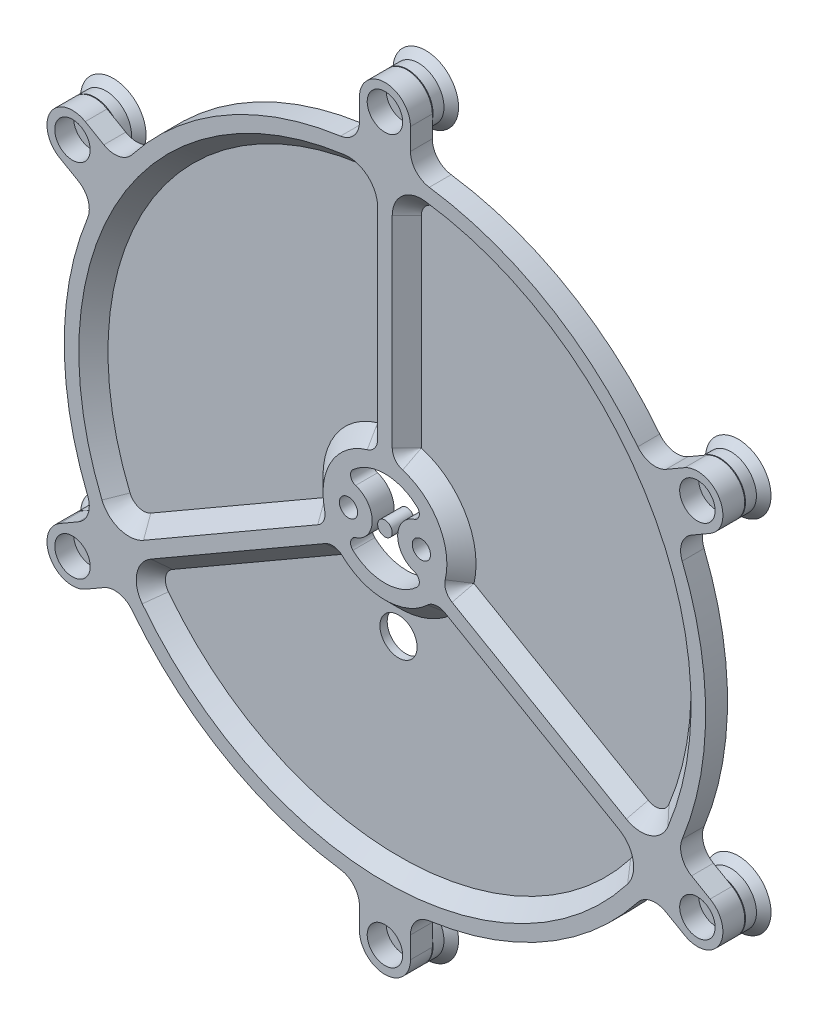
from build123d import *

# Parameters (mm, degrees)
SKETCH1_R                = 44
SKETCH1_R_2              = 42
BOSS_EXTRUDE1_DEPTH      = 1.5
SKETCH1_R_3              = 8.5
BOSS_EXTRUDE1_2_DEPTH    = 1.5
BOSS_EXTRUDE3_START      = -1.5
SKETCH1_3_R              = 42
SKETCH1_3_R_2            = 8.5
BOSS_EXTRUDE3_DEPTH      = 1
BOSS_EXTRUDE2_DEPTH      = 1.5
CIRPATTERN1_COUNT        = 3
CUT_EXTRUDE1_DEPTH       = 63.243473553
CUT_EXTRUDE1_DEPTH_BACK  = 63.243473553
SKETCH3_R                = 1.25
CUT_EXTRUDE2_DEPTH       = 63.243473553
CUT_EXTRUDE2_DEPTH_BACK  = 63.243473553
FILLET1_R                = 1
FILLET2_R                = 4
FILLET3_R                = 2
CHAMFER1_SIZE            = 2
SKETCH6_R                = 2.55
CUT_EXTRUDE3_DEPTH       = 63.297672655
BOSS_EXTRUDE4_START      = -3
BOSS_EXTRUDE4_DEPTH      = 3
FILLET4_R                = 3
CUT_EXTRUDE4_START       = -3
SKETCH9_R                = 2.43125
CUT_EXTRUDE4_DEPTH       = 2.6
CIRPATTERN2_COUNT        = 6
FILLET4_OF_CIRPATTERN2_R = 3
BOSS_EXTRUDE5_START      = 0.1
SKETCH11_R               = 2.40625
BOSS_EXTRUDE5_DEPTH      = 1.6
CIRPATTERN3_COUNT        = 6
BOSS_EXTRUDE6_START      = -1.5
SKETCH12_R               = 1
BOSS_EXTRUDE6_DEPTH      = 3


with BuildPart() as part:
    # Sketch1 → Boss-Extrude1 (new, symmetric)
    with BuildSketch(Plane.XY):
        Circle(SKETCH1_R)
        Circle(SKETCH1_R_2, mode=Mode.SUBTRACT)
    extrude(amount=BOSS_EXTRUDE1_DEPTH, both=True)



with BuildPart() as body_2:
    # Sketch1 → Boss-Extrude1 2 (new, symmetric)
    with BuildSketch(Plane.XY):
        Circle(SKETCH1_R_3)
    extrude(amount=BOSS_EXTRUDE1_2_DEPTH, both=True)


with BuildPart() as part_1:
    add(part.part)

    add(body_2.part)  # Boss-Extrude3 merges body 2
    # Sketch1<3> → Boss-Extrude3 (add)
    with BuildSketch(Plane.XY.offset(BOSS_EXTRUDE3_START)):
        Circle(SKETCH1_3_R)
        Circle(SKETCH1_3_R_2, mode=Mode.SUBTRACT)
    extrude(amount=BOSS_EXTRUDE3_DEPTH)

    # Sketch2 → Boss-Extrude2 (add, symmetric)
    with BuildSketch(Plane.XY):
        with BuildLine():
            Line((-1, 41.98809355), (-1, 0))
            Line((-1, 0), (1, 0))
            Line((1, 0), (1, 41.98809355))
            ThreePointArc((1, 41.98809355), (0, 42), (-1, 41.98809355))
        make_face()
    boss_extrude2 = extrude(amount=BOSS_EXTRUDE2_DEPTH, both=True)

    # CirPattern1: Boss-Extrude2 ×3 about axis
    cirpattern1_axis = Axis((0, 0, 0), (0, 0, 1))
    for i in range(1, CIRPATTERN1_COUNT):
        add(boss_extrude2.rotate(cirpattern1_axis, i * 360 / CIRPATTERN1_COUNT))

    # Sketch3 → Cut-Extrude1 (cut, two sides: drawn at the far end of the back side and taken through both)
    with BuildSketch(Plane.XY.offset(-CUT_EXTRUDE1_DEPTH_BACK)):
        with Locations((-5, 0)):
            Circle(SKETCH3_R)
        with Locations((5, 0)):
            Circle(SKETCH3_R)
    extrude(amount=CUT_EXTRUDE1_DEPTH + CUT_EXTRUDE1_DEPTH_BACK, mode=Mode.SUBTRACT)

    # Sketch5 → Cut-Extrude2 (cut, two sides: drawn at the far end of the back side and taken through both)
    with BuildSketch(Plane.XY.offset(-CUT_EXTRUDE2_DEPTH_BACK)):
        with BuildLine():
            ThreePointArc((-5.66875, -3.180451766), (-1.75, 0), (-5.66875, 3.180451766))
            ThreePointArc((-5.66875, 3.180451766), (0, 6.5), (5.66875, 3.180451766))
            ThreePointArc((5.66875, 3.180451766), (1.75, 0), (5.66875, -3.180451766))
            ThreePointArc((5.66875, -3.180451766), (0, -6.5), (-5.66875, -3.180451766))
        make_face()
    extrude(amount=CUT_EXTRUDE2_DEPTH + CUT_EXTRUDE2_DEPTH_BACK, mode=Mode.SUBTRACT)

    # Fillet1
    fillet1_edges = [part_1.edges().sort_by_distance(p)[0] for p in [
        (5.66875, 3.180451766, 0),
        (5.66875, -3.180451766, 0),
        (-5.66875, -3.180451766, 0),
        (-5.66875, 3.180451766, 0),
    ]]
    fillet(fillet1_edges, radius=FILLET1_R)

    # Fillet2
    fillet2_edges = [part_1.edges().sort_by_distance(p)[0] for p in [
        (1, 41.98809355, 0.5),
        (-1, 41.98809355, 0.5),
        (-35.862755671, -21.860072179, 0.5),
        (-36.862755671, -20.128021371, 0.5),
        (35.862755671, -21.860072179, 0.5),
        (36.862755671, -20.128021371, 0.5),
    ]]
    fillet(fillet2_edges, radius=FILLET2_R)

    # Fillet3
    fillet3_edges = [part_1.edges().sort_by_distance(p)[0] for p in [
        (-1, 8.440971508, 0.5),
        (1, 8.440971508, 0.5),
        (-6.810095759, -5.086511158, 0.5),
        (-7.810095759, -3.35446035, 0.5),
        (6.810095759, -5.086511158, 0.5),
        (7.810095759, -3.35446035, 0.5),
    ]]
    fillet(fillet3_edges, radius=FILLET3_R)

    # Chamfer1
    chamfer1_edges = [part_1.edges().sort_by_distance(p)[0] for p in [
        (34.046399663, -22.386657061, -0.5),
        (0, -42, -0.5),
        (-34.046399663, -22.386657061, -0.5),
        (-20.168528643, -12.799005979, -0.5),
        (-6.980897916, -5.642884706, -0.5),
        (0, -8.5, -0.5),
        (6.980897916, -5.642884706, -0.5),
        (20.168528643, -12.799005979, -0.5),
        (2.364213889, 40.678375546, -0.5),
        (36.373066959, 21, -0.5),
        (36.410613553, -18.291718485, -0.5),
        (21.168528643, -11.066955172, -0.5),
        (8.377330464, -3.224192583, -0.5),
        (7.361215932, 4.25, -0.5),
        (1.396432549, 8.867077289, -0.5),
        (1, 23.865961151, -0.5),
        (-8.377330464, -3.224192583, -0.5),
        (-21.168528643, -11.066955172, -0.5),
        (-36.410613553, -18.291718485, -0.5),
        (-36.373066959, 21, -0.5),
        (-2.364213889, 40.678375546, -0.5),
        (-1, 23.865961151, -0.5),
        (-1.396432549, 8.867077289, -0.5),
        (-7.361215932, 4.25, -0.5),
    ]]
    chamfer(chamfer1_edges, length=CHAMFER1_SIZE - 0.0001)  # a hair under: the kernel refuses the full size

    # Sketch6 → Cut-Extrude3 (cut, through all)
    with BuildSketch(Plane(origin=(0, 0, -1.5), x_dir=(-1, 0, 0), z_dir=(0, 0, -1))):
        with Locations((0.14, -13.9)):
            Circle(SKETCH6_R)
    extrude(amount=-CUT_EXTRUDE3_DEPTH, mode=Mode.SUBTRACT)

    # Sketch8 → Boss-Extrude4 (add)
    with BuildSketch(Plane(origin=(0, 0, -1.5), x_dir=(-1, 0, 0), z_dir=(0, 0, -1)).offset(BOSS_EXTRUDE4_START)):
        with BuildLine():
            Line((-3.5, 49.5), (-3.5, 43.860574552))
            ThreePointArc((-3.5, 43.860574552), (0, 44), (3.5, 43.860574552))
            Line((3.5, 43.860574552), (3.5, 49.5))
            ThreePointArc((3.5, 49.5), (0, 53), (-3.5, 49.5))
        make_face()
    boss_extrude4 = extrude(amount=BOSS_EXTRUDE4_DEPTH)

    # Fillet4
    fillet4_edges = [part_1.edges().sort_by_distance(p)[0] for p in [
        (3.5, 43.860574552, 0),
        (-3.5, 43.860574552, 0),
    ]]
    fillet(fillet4_edges, radius=FILLET4_R)

    # Sketch9 → Cut-Extrude4 (cut)
    with BuildSketch(Plane(origin=(0, 0, -1.5), x_dir=(-1, 0, 0), z_dir=(0, 0, -1)).offset(CUT_EXTRUDE4_START)):
        with Locations(Location((0, 49.5, 0), (0, 0, 180))):
            Circle(SKETCH9_R)
    cut_extrude4 = extrude(amount=CUT_EXTRUDE4_DEPTH, mode=Mode.SUBTRACT)

    # CirPattern2: Boss-Extrude4, Cut-Extrude4 ×6 about axis
    cirpattern2_axis = Axis((0, 0, 0), (0, 0, 1))
    add([boss_extrude4.rotate(cirpattern2_axis, i * 360 / CIRPATTERN2_COUNT) for i in range(1, CIRPATTERN2_COUNT)])
    add([cut_extrude4.rotate(cirpattern2_axis, i * 360 / CIRPATTERN2_COUNT) for i in range(1, CIRPATTERN2_COUNT)], mode=Mode.SUBTRACT)

    # Fillet4 of CirPattern2
    fillet4_of_cirpattern2_edges = [part_1.edges().sort_by_distance(p)[0] for p in [
        (-36.234371786, 24.961376189, 0),
        (-39.734371786, 18.899198363, 0),
        (-39.734371786, -18.899198363, 0),
        (-36.234371786, -24.961376189, 0),
        (-3.5, -43.860574552, 0),
        (3.5, -43.860574552, 0),
        (36.234371786, -24.961376189, 0),
        (39.734371786, -18.899198363, 0),
        (39.734371786, 18.899198363, 0),
        (36.234371786, 24.961376189, 0),
    ]]
    fillet(fillet4_of_cirpattern2_edges, radius=FILLET4_OF_CIRPATTERN2_R)


with BuildPart() as body_2_2:
    # Sketch10 → Revolve1 (revolve)
    with BuildSketch(Plane(origin=(0, 0, 0), x_dir=(0, 0, -1), z_dir=(1, 0, 0)), mode=Mode.PRIVATE) as revolve1_sk:
        Polygon((1.6, 53), (1.6, 52.00625), (3.3, 52.00625), (3.3, 49.5), (4.1, 49.5), (4.1, 54), (3.1, 53), align=None)
    revolve(revolve1_sk.sketch.rotate(Axis((0, 49.5, 10.748258215), (0, 0, -1)), 90), axis=Axis((0, 49.5, 10.748258215), (0, 0, -1)))


with BuildPart() as body_3:
    # Sketch11 → Boss-Extrude5 (new body)
    with BuildSketch(Plane.XY.offset(-3.3).offset(BOSS_EXTRUDE5_START)):
        with Locations(Location((0, 49.5, 0), (0, 0, 180))):
            Circle(SKETCH11_R)
    extrude(amount=BOSS_EXTRUDE5_DEPTH)


with BuildPart() as cirpattern3_1:
    # CirPattern3: pattern copy
    add(body_3.part.rotate(Axis((0, 0, 0), (0, 0, 1)), 1 * 360 / CIRPATTERN3_COUNT))


with BuildPart() as cirpattern3_2:
    # CirPattern3: pattern copy
    add(body_3.part.rotate(Axis((0, 0, 0), (0, 0, 1)), 2 * 360 / CIRPATTERN3_COUNT))


with BuildPart() as cirpattern3_3:
    # CirPattern3: pattern copy
    add(body_3.part.rotate(Axis((0, 0, 0), (0, 0, 1)), 3 * 360 / CIRPATTERN3_COUNT))


with BuildPart() as cirpattern3_4:
    # CirPattern3: pattern copy
    add(body_3.part.rotate(Axis((0, 0, 0), (0, 0, 1)), 4 * 360 / CIRPATTERN3_COUNT))


with BuildPart() as cirpattern3_5:
    # CirPattern3: pattern copy
    add(body_3.part.rotate(Axis((0, 0, 0), (0, 0, 1)), 5 * 360 / CIRPATTERN3_COUNT))


with BuildPart() as cirpattern3_6:
    # CirPattern3: pattern copy
    add(body_2_2.part.rotate(Axis((0, 0, 0), (0, 0, 1)), 1 * 360 / CIRPATTERN3_COUNT))


with BuildPart() as cirpattern3_7:
    # CirPattern3: pattern copy
    add(body_2_2.part.rotate(Axis((0, 0, 0), (0, 0, 1)), 2 * 360 / CIRPATTERN3_COUNT))


with BuildPart() as cirpattern3_8:
    # CirPattern3: pattern copy
    add(body_2_2.part.rotate(Axis((0, 0, 0), (0, 0, 1)), 3 * 360 / CIRPATTERN3_COUNT))


with BuildPart() as cirpattern3_9:
    # CirPattern3: pattern copy
    add(body_2_2.part.rotate(Axis((0, 0, 0), (0, 0, 1)), 4 * 360 / CIRPATTERN3_COUNT))


with BuildPart() as cirpattern3_10:
    # CirPattern3: pattern copy
    add(body_2_2.part.rotate(Axis((0, 0, 0), (0, 0, 1)), 5 * 360 / CIRPATTERN3_COUNT))


with BuildPart() as body_14:
    # Sketch12 → Boss-Extrude6 (new body)
    with BuildSketch(Plane.XY.offset(BOSS_EXTRUDE6_START)):
        Circle(SKETCH12_R)
    extrude(amount=BOSS_EXTRUDE6_DEPTH)


solid = Compound([part_1.part, body_2_2.part, body_3.part, cirpattern3_1.part, cirpattern3_2.part, cirpattern3_3.part, cirpattern3_4.part, cirpattern3_5.part, cirpattern3_6.part, cirpattern3_7.part, cirpattern3_8.part, cirpattern3_9.part, cirpattern3_10.part, body_14.part])
